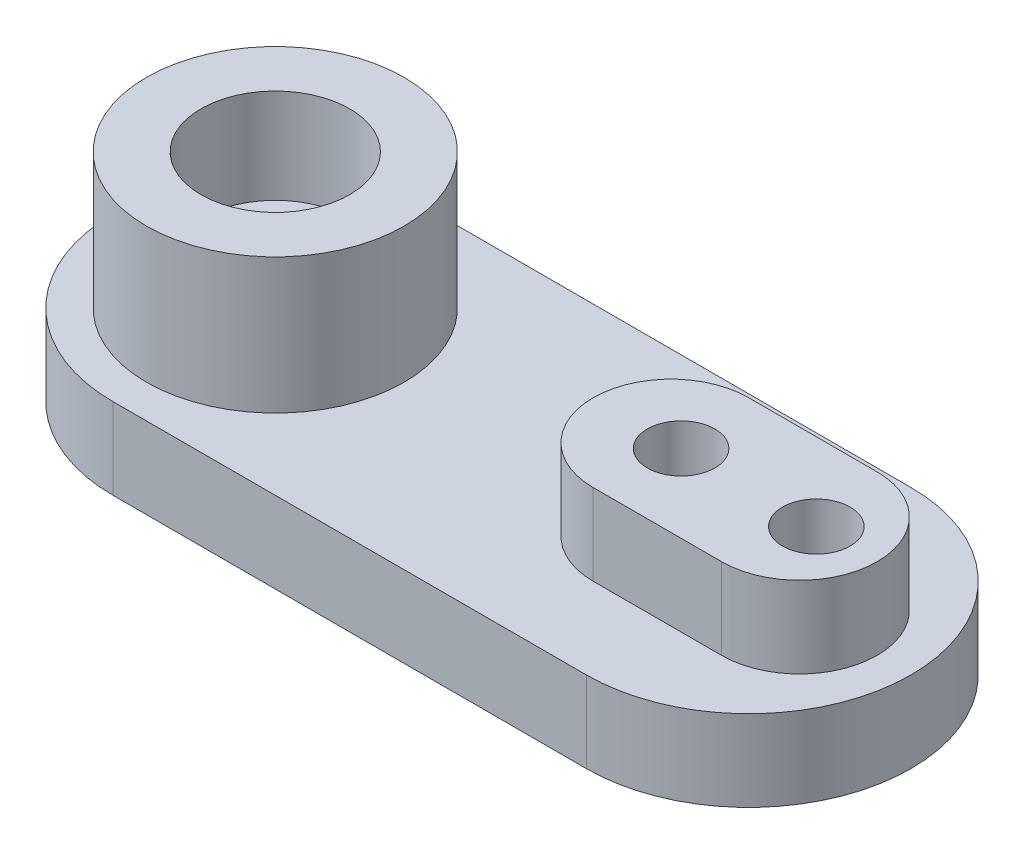
from build123d import *

# Parameters (mm, degrees)
BOSS_EXTRUDE1_DEPTH = 3
SKETCH2_R           = 4.7625
BOSS_EXTRUDE2_DEPTH = 5
BOSS_EXTRUDE3_DEPTH = 3
SKETCH4_R           = 2.75
CUT_EXTRUDE1_DEPTH  = 3.5
SKETCH5_R           = 1.25
CUT_EXTRUDE2_DEPTH  = 25.984995497
SKETCH6_R           = 1.75
CUT_EXTRUDE3_DEPTH  = 25.667792767
SKETCH7_R           = 3
CUT_EXTRUDE4_DEPTH  = 2.5


with BuildPart() as part:
    # Sketch1 → Boss-Extrude1 (new body)
    with BuildSketch(Plane(origin=(0, 0, 0), x_dir=(1, 0, 0), z_dir=(0, 1, 0))):
        with BuildLine():
            Line((0, 6), (17.5, 6))
            ThreePointArc((17.5, 6), (23.5, 0), (17.5, -6))
            Line((17.5, -6), (0, -6))
            ThreePointArc((0, -6), (-6, 0), (0, 6))
        make_face()
    extrude(amount=BOSS_EXTRUDE1_DEPTH)

    # Sketch2 → Boss-Extrude2 (add)
    with BuildSketch(Plane(origin=(0, 3, 0), x_dir=(1, 0, 0), z_dir=(0, 1, 0))):
        Circle(SKETCH2_R)
    extrude(amount=BOSS_EXTRUDE2_DEPTH)

    # Sketch3 → Boss-Extrude3 (add)
    with BuildSketch(Plane(origin=(0, 3, 0), x_dir=(1, 0, 0), z_dir=(0, 1, 0))):
        with BuildLine():
            Line((19.375, -2.875), (14.625, -2.875))
            ThreePointArc((14.625, -2.875), (11.75, 0), (14.625, 2.875))
            Line((14.625, 2.875), (19.375, 2.875))
            ThreePointArc((19.375, 2.875), (22.25, 0), (19.375, -2.875))
        make_face()
    extrude(amount=BOSS_EXTRUDE3_DEPTH)

    # Sketch4 → Cut-Extrude1 (cut)
    with BuildSketch(Plane(origin=(0, 8, 0), x_dir=(1, 0, 0), z_dir=(0, 1, 0))):
        Circle(SKETCH4_R)
    extrude(amount=-CUT_EXTRUDE1_DEPTH, mode=Mode.SUBTRACT)

    # Sketch5 → Cut-Extrude2 (cut, through all)
    with BuildSketch(Plane(origin=(0, 6, 0), x_dir=(1, 0, 0), z_dir=(0, 1, 0))):
        with Locations((20, 0)):
            Circle(SKETCH5_R)
        with Locations((15, 0)):
            Circle(SKETCH5_R)
    extrude(amount=-CUT_EXTRUDE2_DEPTH, mode=Mode.SUBTRACT)

    # Sketch6 → Cut-Extrude3 (cut, through all)
    with BuildSketch(Plane(origin=(0, 4.5, 0), x_dir=(1, 0, 0), z_dir=(0, 1, 0))):
        Circle(SKETCH6_R)
    extrude(amount=-CUT_EXTRUDE3_DEPTH, mode=Mode.SUBTRACT)

    # Sketch7 → Cut-Extrude4 (cut)
    with BuildSketch(Plane.XZ):
        Circle(SKETCH7_R)
    extrude(amount=-CUT_EXTRUDE4_DEPTH, mode=Mode.SUBTRACT)


solid = part.part
